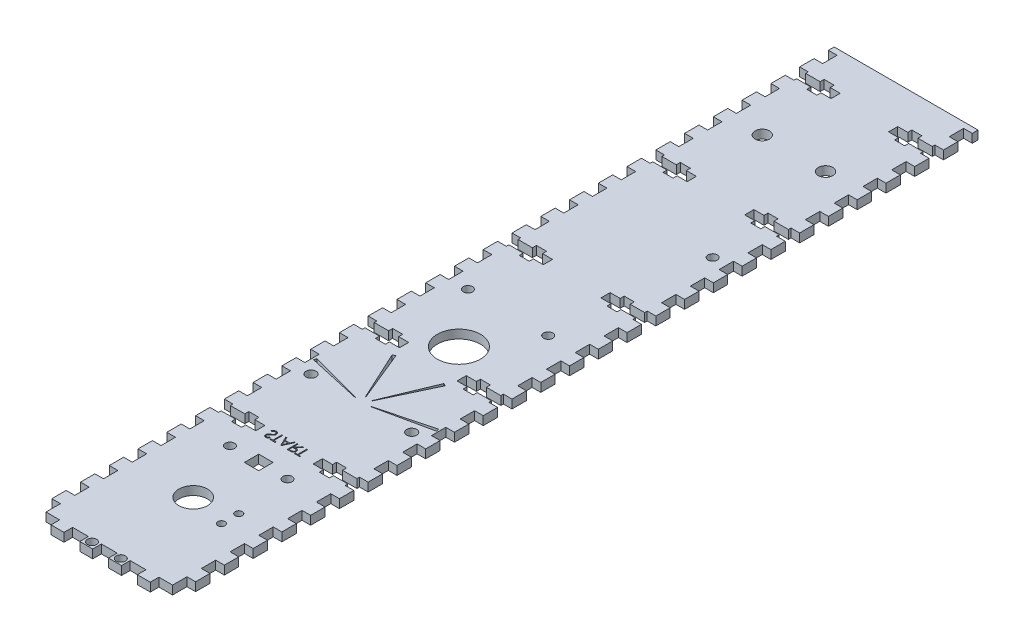
from build123d import *

# Parameters (mm, degrees)
SKETCH1_W                = 50
SKETCH1_H                = 3
BOSS_EXTRUDE1_DEPTH      = 277
SKETCH3_W                = 3
SKETCH3_H                = 5
CUT_EXTRUDE1_DEPTH       = 3
SKETCH6_W                = 4.5
SKETCH6_H                = 3
BOSS_EXTRUDE2_DEPTH      = 3
SKETCH9_W                = 3.2
SKETCH9_H                = 3
CUT_EXTRUDE2_DEPTH       = 12
SKETCH10_W               = 3.2
SKETCH10_H               = 3
CUT_EXTRUDE3_DEPTH       = 12
SKETCH11_W               = 3.5
SKETCH11_H               = 6
CUT_EXTRUDE4_DEPTH       = 12
SKETCH12_R               = 1.6
CUT_EXTRUDE5_DEPTH       = 12
SKETCH13_W               = 13.507600327
SKETCH13_H               = 7.782716217
SKETCH13_W_2             = 12.746384977
SKETCH13_H_2             = 8.044998476
BOSS_EXTRUDE3_DEPTH      = 3
SKETCH14_R               = 2.5
CUT_EXTRUDE6_DEPTH       = 292.149515035
SKETCH15_R               = 1.6
SKETCH15_R_2             = 7.5
CUT_EXTRUDE7_DEPTH       = 292.149515035
SKETCH16_R               = 1.25
SKETCH16_R_2             = 5
CUT_EXTRUDE8_DEPTH       = 292.149515035
SKETCH17_R               = 1.6
SKETCH17_W               = 5
SKETCH17_H               = 5
CUT_EXTRUDE9_DEPTH       = 10
CUT_EXTRUDE10_DEPTH      = 292.14951516
CUT_EXTRUDE10_DEPTH_BACK = 292.14951516
SKETCH18_R               = 1.75


with BuildPart() as part:
    # Sketch1 → Boss-Extrude1 (new body)
    with BuildSketch(Plane.XY):
        with Locations((-54.743589744, 28.628205128)):
            Rectangle(SKETCH1_W, SKETCH1_H)
    extrude(amount=BOSS_EXTRUDE1_DEPTH)

    # Sketch3 → Cut-Extrude1 (cut)
    with BuildSketch(Plane(origin=(0, 30.128205128, 0), x_dir=(1, 0, 0), z_dir=(0, 1, 0))):
        with Locations((-78.243589744, -274.5)):
            Rectangle(SKETCH3_W, SKETCH3_H)
        with Locations((-31.243589744, -274.5)):
            Rectangle(SKETCH3_W, SKETCH3_H)
        with Locations((-78.243589744, -264.5)):
            Rectangle(SKETCH3_W, SKETCH3_H)
        with Locations((-31.243589744, -264.5)):
            Rectangle(SKETCH3_W, SKETCH3_H)
        with Locations((-78.243589744, -254.5)):
            Rectangle(SKETCH3_W, SKETCH3_H)
        with Locations((-31.243589744, -254.5)):
            Rectangle(SKETCH3_W, SKETCH3_H)
        with Locations((-78.243589744, -244.5)):
            Rectangle(SKETCH3_W, SKETCH3_H)
        with Locations((-31.243589744, -244.5)):
            Rectangle(SKETCH3_W, SKETCH3_H)
        with Locations((-78.243589744, -234.5)):
            Rectangle(SKETCH3_W, SKETCH3_H)
        with Locations((-31.243589744, -234.5)):
            Rectangle(SKETCH3_W, SKETCH3_H)
        with Locations((-78.243589744, -224.5)):
            Rectangle(SKETCH3_W, SKETCH3_H)
        with Locations((-31.243589744, -224.5)):
            Rectangle(SKETCH3_W, SKETCH3_H)
        with Locations((-78.243589744, -214.5)):
            Rectangle(SKETCH3_W, SKETCH3_H)
        with Locations((-31.243589744, -214.5)):
            Rectangle(SKETCH3_W, SKETCH3_H)
        with Locations((-78.243589744, -204.5)):
            Rectangle(SKETCH3_W, SKETCH3_H)
        with Locations((-31.243589744, -204.5)):
            Rectangle(SKETCH3_W, SKETCH3_H)
        with Locations((-78.243589744, -194.5)):
            Rectangle(SKETCH3_W, SKETCH3_H)
        with Locations((-31.243589744, -194.5)):
            Rectangle(SKETCH3_W, SKETCH3_H)
        with Locations((-78.243589744, -184.5)):
            Rectangle(SKETCH3_W, SKETCH3_H)
        with Locations((-31.243589744, -184.5)):
            Rectangle(SKETCH3_W, SKETCH3_H)
        with Locations((-78.243589744, -174.5)):
            Rectangle(SKETCH3_W, SKETCH3_H)
        with Locations((-31.243589744, -174.5)):
            Rectangle(SKETCH3_W, SKETCH3_H)
        with Locations((-78.243589744, -164.5)):
            Rectangle(SKETCH3_W, SKETCH3_H)
        with Locations((-31.243589744, -164.5)):
            Rectangle(SKETCH3_W, SKETCH3_H)
        with Locations((-78.243589744, -154.5)):
            Rectangle(SKETCH3_W, SKETCH3_H)
        with Locations((-31.243589744, -154.5)):
            Rectangle(SKETCH3_W, SKETCH3_H)
        with Locations((-78.243589744, -144.5)):
            Rectangle(SKETCH3_W, SKETCH3_H)
        with Locations((-31.243589744, -144.5)):
            Rectangle(SKETCH3_W, SKETCH3_H)
        with Locations((-78.243589744, -134.5)):
            Rectangle(SKETCH3_W, SKETCH3_H)
        with Locations((-31.243589744, -134.5)):
            Rectangle(SKETCH3_W, SKETCH3_H)
        with Locations((-78.243589744, -124.5)):
            Rectangle(SKETCH3_W, SKETCH3_H)
        with Locations((-31.243589744, -124.5)):
            Rectangle(SKETCH3_W, SKETCH3_H)
        with Locations((-78.243589744, -114.5)):
            Rectangle(SKETCH3_W, SKETCH3_H)
        with Locations((-31.243589744, -114.5)):
            Rectangle(SKETCH3_W, SKETCH3_H)
        with Locations((-78.243589744, -104.5)):
            Rectangle(SKETCH3_W, SKETCH3_H)
        with Locations((-31.243589744, -104.5)):
            Rectangle(SKETCH3_W, SKETCH3_H)
        with Locations((-78.243589744, -94.5)):
            Rectangle(SKETCH3_W, SKETCH3_H)
        with Locations((-31.243589744, -94.5)):
            Rectangle(SKETCH3_W, SKETCH3_H)
        with Locations((-78.243589744, -84.5)):
            Rectangle(SKETCH3_W, SKETCH3_H)
        with Locations((-31.243589744, -84.5)):
            Rectangle(SKETCH3_W, SKETCH3_H)
        with Locations((-78.243589744, -74.5)):
            Rectangle(SKETCH3_W, SKETCH3_H)
        with Locations((-31.243589744, -74.5)):
            Rectangle(SKETCH3_W, SKETCH3_H)
        with Locations((-78.243589744, -64.5)):
            Rectangle(SKETCH3_W, SKETCH3_H)
        with Locations((-31.243589744, -64.5)):
            Rectangle(SKETCH3_W, SKETCH3_H)
        with Locations((-78.243589744, -54.5)):
            Rectangle(SKETCH3_W, SKETCH3_H)
        with Locations((-31.243589744, -54.5)):
            Rectangle(SKETCH3_W, SKETCH3_H)
        with Locations((-78.243589744, -44.5)):
            Rectangle(SKETCH3_W, SKETCH3_H)
        with Locations((-31.243589744, -44.5)):
            Rectangle(SKETCH3_W, SKETCH3_H)
        with Locations((-78.243589744, -34.5)):
            Rectangle(SKETCH3_W, SKETCH3_H)
        with Locations((-31.243589744, -34.5)):
            Rectangle(SKETCH3_W, SKETCH3_H)
        with Locations((-78.243589744, -24.5)):
            Rectangle(SKETCH3_W, SKETCH3_H)
        with Locations((-31.243589744, -24.5)):
            Rectangle(SKETCH3_W, SKETCH3_H)
        with Locations((-78.243589744, -14.5)):
            Rectangle(SKETCH3_W, SKETCH3_H)
        with Locations((-31.243589744, -14.5)):
            Rectangle(SKETCH3_W, SKETCH3_H)
        with Locations((-78.243589744, -4.5)):
            Rectangle(SKETCH3_W, SKETCH3_H)
        with Locations((-31.243589744, -4.5)):
            Rectangle(SKETCH3_W, SKETCH3_H)
    extrude(amount=-CUT_EXTRUDE1_DEPTH, mode=Mode.SUBTRACT)

    # Sketch6 → Boss-Extrude2 (add)
    with BuildSketch(Plane.XY.offset(277)):
        with Locations((-69.743589744, 28.628205128)):
            Rectangle(SKETCH6_W, SKETCH6_H)
        with Locations((-59.743589744, 28.628205128)):
            Rectangle(SKETCH6_W, SKETCH6_H)
        with Locations((-49.743589744, 28.628205128)):
            Rectangle(SKETCH6_W, SKETCH6_H)
        with Locations((-39.743589744, 28.628205128)):
            Rectangle(SKETCH6_W, SKETCH6_H)
    extrude(amount=BOSS_EXTRUDE2_DEPTH)

    # Sketch9 → Cut-Extrude2 (cut)
    with BuildSketch(Plane(origin=(-32.743589744, 0, 0), x_dir=(0, 0, -1), z_dir=(1, 0, 0))):
        with Locations((-264.5, 28.628205128)):
            Rectangle(SKETCH9_W, SKETCH9_H)
        with Locations((-214.5, 28.628205128)):
            Rectangle(SKETCH9_W, SKETCH9_H)
        with Locations((-164.5, 28.628205128)):
            Rectangle(SKETCH9_W, SKETCH9_H)
        with Locations((-114.5, 28.628205128)):
            Rectangle(SKETCH9_W, SKETCH9_H)
        with Locations((-64.5, 28.628205128)):
            Rectangle(SKETCH9_W, SKETCH9_H)
        with Locations((-14.5, 28.628205128)):
            Rectangle(SKETCH9_W, SKETCH9_H)
    extrude(amount=-CUT_EXTRUDE2_DEPTH, mode=Mode.SUBTRACT)

    # Sketch10 → Cut-Extrude3 (cut)
    with BuildSketch(Plane.ZY.offset(76.743589744)):
        with Locations((264.5, 28.628205128)):
            Rectangle(SKETCH10_W, SKETCH10_H)
        with Locations((214.5, 28.628205128)):
            Rectangle(SKETCH10_W, SKETCH10_H)
        with Locations((164.5, 28.628205128)):
            Rectangle(SKETCH10_W, SKETCH10_H)
        with Locations((114.5, 28.628205128)):
            Rectangle(SKETCH10_W, SKETCH10_H)
        with Locations((64.5, 28.628205128)):
            Rectangle(SKETCH10_W, SKETCH10_H)
        with Locations((14.5, 28.628205128)):
            Rectangle(SKETCH10_W, SKETCH10_H)
    extrude(amount=-CUT_EXTRUDE3_DEPTH, mode=Mode.SUBTRACT)

    # Sketch11 → Cut-Extrude4 (cut)
    with BuildSketch(Plane.XZ.offset(-27.128205128)):
        with Locations((-69.993589744, 264.5)):
            Rectangle(SKETCH11_W, SKETCH11_H)
        with Locations((-39.493589744, 264.5)):
            Rectangle(SKETCH11_W, SKETCH11_H)
        with Locations((-69.993589744, 214.5)):
            Rectangle(SKETCH11_W, SKETCH11_H)
        with Locations((-39.493589744, 214.5)):
            Rectangle(SKETCH11_W, SKETCH11_H)
        with Locations((-69.993589744, 164.5)):
            Rectangle(SKETCH11_W, SKETCH11_H)
        with Locations((-39.493589744, 164.5)):
            Rectangle(SKETCH11_W, SKETCH11_H)
        with Locations((-69.993589744, 114.5)):
            Rectangle(SKETCH11_W, SKETCH11_H)
        with Locations((-39.493589744, 114.5)):
            Rectangle(SKETCH11_W, SKETCH11_H)
        with Locations((-69.993589744, 64.5)):
            Rectangle(SKETCH11_W, SKETCH11_H)
        with Locations((-39.493589744, 64.5)):
            Rectangle(SKETCH11_W, SKETCH11_H)
        with Locations((-69.993589744, 14.5)):
            Rectangle(SKETCH11_W, SKETCH11_H)
        with Locations((-39.493589744, 14.5)):
            Rectangle(SKETCH11_W, SKETCH11_H)
    extrude(amount=-CUT_EXTRUDE4_DEPTH, mode=Mode.SUBTRACT)

    # Sketch12 → Cut-Extrude5 (cut)
    with BuildSketch(Plane.XZ.offset(-27.128205128)):
        with Locations((-59.743589744, 278)):
            Circle(SKETCH12_R)
        with Locations((-49.743589744, 278)):
            Circle(SKETCH12_R)
    extrude(amount=-CUT_EXTRUDE5_DEPTH, mode=Mode.SUBTRACT)

    # Sketch13 → Boss-Extrude3 (add)
    with BuildSketch(Plane.XZ.offset(-27.128205128)):
        with Locations((-69.989789581, 264.201168399)):
            Rectangle(SKETCH13_W, SKETCH13_H)
        with Locations((-39.116782233, 264.897933796)):
            Rectangle(SKETCH13_W_2, SKETCH13_H_2)
    extrude(amount=-BOSS_EXTRUDE3_DEPTH)

    # Sketch14 → Cut-Extrude6 (cut, through all)
    with BuildSketch(Plane.XZ.offset(-27.128205128)):
        with Locations((-65.743589744, 39)):
            Circle(SKETCH14_R)
        with Locations((-43.743589744, 39)):
            Circle(SKETCH14_R)
    extrude(amount=-CUT_EXTRUDE6_DEPTH, mode=Mode.SUBTRACT)

    # Sketch15 → Cut-Extrude7 (cut, through all)
    with BuildSketch(Plane.XZ.offset(-27.128205128)):
        with Locations((-70.450886663, 136.602790149)):
            Circle(SKETCH15_R)
        with Locations((-42.550886663, 136.602790149)):
            Circle(SKETCH15_R)
        with Locations((-37.500886663, 84.502790149)):
            Circle(SKETCH15_R)
        with Locations((-54.743589744, 155.461682015)):
            Circle(SKETCH15_R_2)
    extrude(amount=-CUT_EXTRUDE7_DEPTH, mode=Mode.SUBTRACT)

    # Sketch16 → Cut-Extrude8 (cut, through all)
    with BuildSketch(Plane.XZ.offset(-27.128205128)):
        with Locations((-42.743589744, 250)):
            Circle(SKETCH16_R)
        with Locations((-42.743589744, 244)):
            Circle(SKETCH16_R)
        with Locations((-55.566311228, 247)):
            Circle(SKETCH16_R_2)
    extrude(amount=-CUT_EXTRUDE8_DEPTH, mode=Mode.SUBTRACT)

    # Sketch17 → Cut-Extrude9 (cut)
    # profile 1 of 8: a face of its own
    with BuildSketch(Plane.XZ.offset(-27.128205128)):
        with Locations((-64.684119458, 225.103941312)):
            Circle(SKETCH17_R)
    # profile 2 of 8: a face of its own
    with BuildSketch(Plane.XZ.offset(-27.128205128)):
        with Locations((-44.684119458, 225.103941312)):
            Circle(SKETCH17_R)
    # profile 3 of 8: a face of its own
    with BuildSketch(Plane.XZ.offset(-27.128205128)):
        with Locations((-54.684119458, 225.103941312)):
            Rectangle(SKETCH17_W, SKETCH17_H)
    # profile 4 of 8: a face of its own
    with BuildSketch(Plane.XZ.offset(-27.128205128)):
        with BuildLine():
            Line((-62.097172473, 213.420253416), (-61.801299075, 213.59763723))
            add(Edge.make_bspline(
                [(-61.801299075, 213.59763723), (-61.773780838, 213.551572845), (-61.721056957, 213.463315261), (-61.633105598, 213.344057221), (-61.541972687, 213.242695064), (-61.446983354, 213.159818456), (-61.348717405, 213.09456957), (-61.246533352, 213.048367338), (-61.140775541, 213.019551363), (-61.068801719, 213.016051276), (-61.032869588, 213.014303897)],
                knots=[0, 0, 0, 0, 1.272034388, 2.437168799, 3.508375237, 4.49857839, 5.41946034, 6.295179144, 7.148887113, 8, 8, 8, 8], degree=3))
            add(Edge.make_bspline(
                [(-61.032869588, 213.014303897), (-61.002182728, 213.015158569), (-60.941345955, 213.016852959), (-60.851783712, 213.033133762), (-60.764801909, 213.05814589), (-60.682193272, 213.093966822), (-60.605097657, 213.137305308), (-60.537490962, 213.189651485), (-60.479044849, 213.248257691), (-60.431235734, 213.313640346), (-60.394555699, 213.383957494), (-60.36636363, 213.456133445), (-60.350718557, 213.531302014), (-60.348361803, 213.581912477), (-60.347172473, 213.607452935)],
                knots=[0, 0, 0, 0, 1.095163259, 2.171163733, 3.241058638, 4.321873601, 5.38011039, 6.391990106, 7.366004449, 8.327778327, 9.272591725, 10.192022065, 11.087607919, 12, 12, 12, 12], degree=3))
            add(Edge.make_bspline(
                [(-60.347172473, 213.607452935), (-60.348646783, 213.636593785), (-60.351643842, 213.695832874), (-60.376975322, 213.783232527), (-60.416824569, 213.869725097), (-60.453587212, 213.923226363), (-60.472673274, 213.951002615)],
                knots=[0, 0, 0, 0, 0.938893495, 1.908633276, 2.914225137, 4, 4, 4, 4], degree=3))
            add(Edge.make_bspline(
                [(-60.472673274, 213.951002615), (-60.488343888, 213.971049438), (-60.521242382, 214.013135237), (-60.577799895, 214.075780472), (-60.644166009, 214.140398891), (-60.718069564, 214.209457948), (-60.802202653, 214.279745745), (-60.893930167, 214.354614023), (-60.995594026, 214.4312156), (-61.066893523, 214.482588165), (-61.103682889, 214.509095563)],
                knots=[0, 0, 0, 0, 0.722233717, 1.516239348, 2.393582979, 3.351407094, 4.387010283, 5.505090956, 6.712668013, 8, 8, 8, 8], degree=3))
            add(Edge.make_bspline(
                [(-61.103682889, 214.509095563), (-61.140506886, 214.535324151), (-61.210911562, 214.585471213), (-61.309370144, 214.659895497), (-61.397414607, 214.727939367), (-61.474653624, 214.790243379), (-61.541053221, 214.846815984), (-61.597136632, 214.897113923), (-61.641475189, 214.942497484), (-61.66613077, 214.971938825), (-61.677200518, 214.985157262)],
                knots=[0, 0, 0, 0, 1.452282411, 2.77665338, 3.964542531, 5.026858415, 5.96415736, 6.766646006, 7.446254459, 8, 8, 8, 8], degree=3))
            add(Edge.make_bspline(
                [(-61.677200518, 214.985157262), (-61.692673063, 215.005758299), (-61.7231019, 215.046273003), (-61.763267905, 215.10959786), (-61.797407068, 215.174421126), (-61.8241694, 215.24091699), (-61.846705619, 215.308151919), (-61.861863549, 215.377003165), (-61.871354946, 215.447161784), (-61.872326933, 215.494375284), (-61.872813498, 215.518009826)],
                knots=[0, 0, 0, 0, 1.068054152, 2.10047183, 3.106115577, 4.101338837, 5.06977816, 6.043150881, 7.020423561, 8, 8, 8, 8], degree=3))
            add(Edge.make_bspline(
                [(-61.872813498, 215.518009826), (-61.871508289, 215.555039601), (-61.868925769, 215.628307664), (-61.847085252, 215.735338495), (-61.812612358, 215.837524912), (-61.76431747, 215.933855246), (-61.702060118, 216.021821227), (-61.630014143, 216.102434714), (-61.544202657, 216.170203296), (-61.450050034, 216.229415354), (-61.346993662, 216.27576128), (-61.239002758, 216.31072226), (-61.125905686, 216.330531517), (-61.049302552, 216.333374282), (-61.010433691, 216.334816717)],
                knots=[0, 0, 0, 0, 1.005424448, 1.989358655, 2.955360095, 3.929531133, 4.905563448, 5.876582895, 6.856512386, 7.866279853, 8.892233794, 9.918561126, 10.94386622, 12, 12, 12, 12], degree=3))
            add(Edge.make_bspline(
                [(-61.010433691, 216.334816717), (-60.96918959, 216.333394166), (-60.887168239, 216.330565165), (-60.766519023, 216.305967633), (-60.650358307, 216.265266961), (-60.556915042, 216.219078303), (-60.48378228, 216.172946888), (-60.428009548, 216.130927063), (-60.371492097, 216.082551955), (-60.313774042, 216.027692709), (-60.255833383, 215.965845958), (-60.19680993, 215.897435269), (-60.136565662, 215.822878713), (-60.097809801, 215.769654212), (-60.077941703, 215.742368801)],
                knots=[0, 0, 0, 0, 1.286793592, 2.559021753, 3.825965368, 5.121522368, 5.803751409, 6.523245864, 7.299691795, 8.125521123, 9.008227632, 9.944561021, 10.946284179, 12, 12, 12, 12], degree=3))
            Line((-60.077941703, 215.742368801), (-60.36189603, 215.52712441))
            add(Edge.make_bspline(
                [(-60.36189603, 215.52712441), (-60.379041963, 215.5492131), (-60.41206102, 215.591750753), (-60.462190507, 215.651322069), (-60.509439155, 215.705738548), (-60.555989554, 215.753003676), (-60.599383186, 215.79570581), (-60.641500228, 215.832265567), (-60.681734579, 215.863041162), (-60.73245149, 215.895884722), (-60.796169208, 215.928441225), (-60.876153745, 215.955990304), (-60.95974002, 215.972545365), (-61.016669651, 215.974734253), (-61.04548978, 215.975842358)],
                knots=[0, 0, 0, 0, 1.181633172, 2.275549214, 3.290209073, 4.226197932, 5.078386478, 5.862611352, 6.581680152, 7.217281963, 8.414376989, 9.595101626, 10.782541182, 12, 12, 12, 12], degree=3))
            add(Edge.make_bspline(
                [(-61.04548978, 215.975842358), (-61.081646303, 215.974630658), (-61.15137075, 215.972294009), (-61.250360986, 215.946774024), (-61.339454911, 215.906592163), (-61.416007476, 215.850277185), (-61.479744453, 215.783556193), (-61.525849912, 215.706777338), (-61.553600077, 215.621994935), (-61.556986356, 215.562853279), (-61.558710934, 215.532733384)],
                knots=[0, 0, 0, 0, 1.14458467, 2.207223713, 3.21896685, 4.227309161, 5.202851033, 6.127160689, 7.046193047, 8, 8, 8, 8], degree=3))
            add(Edge.make_bspline(
                [(-61.558710934, 215.532733384), (-61.558317808, 215.513981905), (-61.557530911, 215.476448286), (-61.546556114, 215.420996864), (-61.532456785, 215.365685525), (-61.510114153, 215.310762942), (-61.479268849, 215.255268583), (-61.438763674, 215.198246845), (-61.387750362, 215.139195136), (-61.348673349, 215.100787763), (-61.328041864, 215.080509826)],
                knots=[0, 0, 0, 0, 0.858281714, 1.717966888, 2.583508476, 3.4729293, 4.427298488, 5.488583878, 6.674047936, 8, 8, 8, 8], degree=3))
            add(Edge.make_bspline(
                [(-61.328041864, 215.080509826), (-61.320380491, 215.0736728), (-61.302178824, 215.057429592), (-61.268902898, 215.030837311), (-61.2249601, 214.998034539), (-61.171497899, 214.957447223), (-61.107530537, 214.910365761), (-61.033050981, 214.857392148), (-60.948889448, 214.796806689), (-60.889167532, 214.754449149), (-60.857589139, 214.732052294)],
                knots=[0, 0, 0, 0, 0.420754252, 0.999615792, 1.744751191, 2.668019286, 3.750313428, 4.999500688, 6.413464383, 8, 8, 8, 8], degree=3))
            add(Edge.make_bspline(
                [(-60.857589139, 214.732052294), (-60.819603226, 214.704410935), (-60.74604877, 214.650887273), (-60.64139119, 214.570471593), (-60.546497382, 214.491823824), (-60.461034178, 214.415446217), (-60.38415727, 214.341918124), (-60.316719549, 214.270354944), (-60.258033869, 214.201269371), (-60.19485465, 214.112696795), (-60.130296831, 214.003915711), (-60.074855323, 213.870637473), (-60.039896976, 213.736841152), (-60.03532546, 213.646914316), (-60.033069909, 213.602545083)],
                knots=[0, 0, 0, 0, 1.163667725, 2.253281268, 3.268753668, 4.215851969, 5.092017293, 5.902905408, 6.650798638, 7.335211899, 8.59617414, 9.77448103, 10.901945474, 12, 12, 12, 12], degree=3))
            add(Edge.make_bspline(
                [(-60.033069909, 213.602545083), (-60.033727047, 213.571166718), (-60.035028562, 213.509019334), (-60.049989476, 213.417764257), (-60.071909141, 213.329133387), (-60.104946375, 213.244222275), (-60.145269533, 213.161477512), (-60.196435781, 213.083069612), (-60.255743466, 213.007263213), (-60.32377723, 212.936079722), (-60.398223133, 212.870733526), (-60.476906827, 212.812604464), (-60.5599571, 212.764136141), (-60.646923417, 212.724585299), (-60.737825754, 212.693651781), (-60.832633538, 212.671238912), (-60.931503049, 212.657483201), (-60.99870353, 212.65605544), (-61.032869588, 212.655329538)],
                knots=[0, 0, 0, 0, 0.983748083, 1.948392443, 2.894712957, 3.844097841, 4.80183111, 5.778335162, 6.776009319, 7.81870978, 8.863265674, 9.881300176, 10.883814829, 11.87499822, 12.874611388, 13.892143829, 14.928324115, 16, 16, 16, 16], degree=3))
            add(Edge.make_bspline(
                [(-61.032869588, 212.655329538), (-61.059304931, 212.655840719), (-61.111842691, 212.656856645), (-61.189552173, 212.665837925), (-61.265691762, 212.678545029), (-61.339306044, 212.698719099), (-61.411343456, 212.723196076), (-61.48149069, 212.753334408), (-61.549781744, 212.78945161), (-61.616599327, 212.830746634), (-61.681773502, 212.878804379), (-61.74469297, 212.934777875), (-61.807422155, 212.99712338), (-61.868109551, 213.067533944), (-61.927982696, 213.144872027), (-61.985861105, 213.22986121), (-62.042942823, 213.322038564), (-62.078758291, 213.38690365), (-62.097172473, 213.420253416)],
                knots=[0, 0, 0, 0, 0.915332311, 1.819136955, 2.706846663, 3.586547465, 4.459518054, 5.340707479, 6.227863349, 7.133153174, 8.059268498, 9.028702269, 10.047606654, 11.120612155, 12.245963614, 13.433783089, 14.680604001, 16, 16, 16, 16], degree=3))
        make_face()
    # profile 5 of 8: a face of its own
    with BuildSketch(Plane.XZ.offset(-27.128205128)):
        Polygon((-59.718967344, 215.886098769), (-59.718967344, 216.245073127), (-57.879223755, 216.245073127), (-57.879223755, 215.886098769), (-58.642044268, 215.886098769), (-58.642044268, 212.745073127), (-58.956146832, 212.745073127), (-58.956146832, 215.886098769), align=None)
    # profile 6 of 8: a face of its own
    with BuildSketch(Plane.XZ.offset(-27.128205128)):
        Polygon((-55.90486478, 216.245073127), (-54.289480165, 212.745073127), (-54.630926479, 212.745073127), (-55.148354364, 213.866867999), (-56.734992986, 213.866867999), (-57.267144428, 212.745073127), (-57.609992986, 212.745073127), (-55.949736575, 216.245073127), align=None)
        Polygon((-55.930806287, 215.562881621), (-56.564620389, 214.225842358), (-55.313819107, 214.225842358), align=None, mode=Mode.SUBTRACT)
    # profile 7 of 8: a face of its own
    with BuildSketch(Plane.XZ.offset(-27.128205128)):
        with BuildLine():
            Line((-53.661275037, 216.245073127), (-52.960854364, 216.245073127))
            add(Edge.make_bspline(
                [(-52.960854364, 216.245073127), (-52.914113235, 216.244917541), (-52.824365091, 216.244618799), (-52.69579182, 216.242953036), (-52.578964723, 216.238178681), (-52.473944884, 216.234070097), (-52.380734229, 216.226578156), (-52.299046938, 216.219417509), (-52.229259241, 216.210043848), (-52.18701339, 216.201338425), (-52.167885614, 216.197396845)],
                knots=[0, 0, 0, 0, 1.410062039, 2.707475311, 3.878576406, 4.937260626, 5.877586885, 6.699081471, 7.410979367, 8, 8, 8, 8], degree=3))
            add(Edge.make_bspline(
                [(-52.167885614, 216.197396845), (-52.14227899, 216.19107008), (-52.091612, 216.178551516), (-52.018661934, 216.152091916), (-51.94914761, 216.121472291), (-51.883357786, 216.085508571), (-51.821621995, 216.043933791), (-51.763303684, 215.997465669), (-51.70813822, 215.946358463), (-51.65835659, 215.889323621), (-51.611417539, 215.829487112), (-51.571828912, 215.764783355), (-51.537702432, 215.697121827), (-51.510531915, 215.625814409), (-51.488653942, 215.551552638), (-51.473227702, 215.473663841), (-51.463976515, 215.392502866), (-51.463034659, 215.337144957), (-51.462557088, 215.309075531)],
                knots=[0, 0, 0, 0, 1.027469482, 2.033020251, 3.019912614, 3.986113645, 4.951240523, 5.91722682, 6.890402269, 7.87763091, 8.8651537, 9.85103654, 10.82876324, 11.815024772, 12.821070561, 13.842952187, 14.906261191, 16, 16, 16, 16], degree=3))
            add(Edge.make_bspline(
                [(-51.462557088, 215.309075531), (-51.464026086, 215.262440427), (-51.466892482, 215.171443259), (-51.493617586, 215.039382377), (-51.537394105, 214.916193063), (-51.597717394, 214.802030425), (-51.67453687, 214.69911978), (-51.766861661, 214.608729324), (-51.874743273, 214.533089412), (-51.975172589, 214.480636607), (-52.063886788, 214.447043698), (-52.136920101, 214.423407339), (-52.216587079, 214.405145374), (-52.302124413, 214.388785242), (-52.393888069, 214.376433548), (-52.491658108, 214.367386953), (-52.59550426, 214.361732905), (-52.666843329, 214.3608909), (-52.703542665, 214.360457743)],
                knots=[0, 0, 0, 0, 1.260483769, 2.459530307, 3.627416485, 4.787058657, 5.939039949, 7.08810263, 8.267026773, 9.491475466, 10.141966685, 10.831826277, 11.566392101, 12.351337768, 13.187381173, 14.07005841, 15.007169909, 16, 16, 16, 16], degree=3))
            Line((-52.703542665, 214.360457743), (-51.417685293, 212.745073127))
            Line((-51.417685293, 212.745073127), (-51.806106768, 212.745073127))
            Line((-51.806106768, 212.745073127), (-53.091964139, 214.360457743))
            Line((-53.091964139, 214.360457743), (-53.347172473, 214.360457743))
            Line((-53.347172473, 214.360457743), (-53.347172473, 212.745073127))
            Line((-53.347172473, 212.745073127), (-53.661275037, 212.745073127))
            Line((-53.661275037, 212.745073127), (-53.661275037, 216.245073127))
        make_face()
        with BuildLine():
            Line((-53.347172473, 215.886098769), (-53.347172473, 214.719432102))
            Line((-53.347172473, 214.719432102), (-52.706347152, 214.714524249))
            add(Edge.make_bspline(
                [(-52.706347152, 214.714524249), (-52.676427113, 214.714511013), (-52.618433556, 214.714485356), (-52.534532891, 214.718479132), (-52.45641278, 214.723022451), (-52.384372027, 214.729971796), (-52.318378452, 214.738927868), (-52.258465039, 214.750130852), (-52.204533987, 214.763182915), (-52.141635449, 214.783384541), (-52.071398917, 214.815390559), (-51.995067457, 214.861956058), (-51.93006512, 214.920525177), (-51.875147257, 214.987498633), (-51.831017826, 215.061134882), (-51.799905772, 215.140551251), (-51.780163329, 215.223742849), (-51.777834784, 215.280920957), (-51.776659652, 215.309776653)],
                knots=[0, 0, 0, 0, 1.146690395, 2.22261258, 3.21895312, 4.145990853, 4.996080663, 5.770904154, 6.481378293, 7.121626537, 8.300444488, 9.431385265, 10.535395872, 11.636531494, 12.74115979, 13.810798291, 14.895190096, 16, 16, 16, 16], degree=3))
            add(Edge.make_bspline(
                [(-51.776659652, 215.309776653), (-51.777861773, 215.337923227), (-51.780243939, 215.393699466), (-51.799692707, 215.475355376), (-51.832582089, 215.552422326), (-51.876904326, 215.624586811), (-51.930903481, 215.690092547), (-51.994221294, 215.7461397), (-52.065126489, 215.792389165), (-52.131397688, 215.821943545), (-52.1906319, 215.840063398), (-52.24206156, 215.852814562), (-52.300173038, 215.863059031), (-52.365248496, 215.871267092), (-52.437010127, 215.878322036), (-52.515820778, 215.883073815), (-52.601157559, 215.885887679), (-52.66030449, 215.886026768), (-52.690922473, 215.886098769)],
                knots=[0, 0, 0, 0, 1.101028733, 2.181837193, 3.264309656, 4.369019818, 5.486613113, 6.575447106, 7.666700264, 8.788928104, 9.402425223, 10.0903467, 10.862060571, 11.710948788, 12.657782767, 13.684531032, 14.801375019, 16, 16, 16, 16], degree=3))
            Line((-52.690922473, 215.886098769), (-53.347172473, 215.886098769))
        make_face(mode=Mode.SUBTRACT)
    # profile 8 of 8: a face of its own
    with BuildSketch(Plane.XZ.offset(-27.128205128)):
        Polygon((-51.103582729, 215.886098769), (-51.103582729, 216.245073127), (-49.263839139, 216.245073127), (-49.263839139, 215.886098769), (-50.026659652, 215.886098769), (-50.026659652, 212.745073127), (-50.340762216, 212.745073127), (-50.340762216, 215.886098769), align=None)
    extrude(amount=-CUT_EXTRUDE9_DEPTH, mode=Mode.SUBTRACT)


with BuildPart() as cut_extrude9_piece_1:
    # of the separate pieces the step leaves, piece 1, a body of its own (cut_extrude9_pieces)
    add(part.part.solids().sort_by_distance((-79.743589744, 30.128205128, 0))[0])

    # Sketch18 → Cut-Extrude10 (cut, two sides: drawn at the far end of the back side and taken through both)
    with BuildSketch(Plane.XZ.offset(-27.128205128).offset(-CUT_EXTRUDE10_DEPTH_BACK)):
        with BuildLine():
            ThreePointArc((-55.763589447, 186.785648856), (-55.82362966, 186.810950523), (-55.88307734, 186.837614637))
            Line((-55.88307734, 186.837614637), (-63.885716991, 169.527030688))
            Line((-63.885716991, 169.527030688), (-62.968687695, 169.128210841))
            Line((-62.968687695, 169.128210841), (-55.763589447, 186.785648856))
        make_face()
        with BuildLine():
            Line((-45.351397134, 169.588175182), (-53.468076163, 186.845581696))
            ThreePointArc((-53.468076163, 186.845581696), (-53.527346621, 186.818525933), (-53.58721859, 186.792828677))
            Line((-53.58721859, 186.792828677), (-46.265775095, 169.183313545))
            Line((-46.265775095, 169.183313545), (-45.351397134, 169.588175182))
        make_face()
        with BuildLine():
            ThreePointArc((-51.89144045, 188.827298206), (-51.905922258, 188.763826415), (-51.92184645, 188.700701055))
            Line((-51.92184645, 188.700701055), (-33.484605376, 183.825590839))
            Line((-33.484605376, 183.825590839), (-33.228974299, 184.792365245))
            Line((-33.228974299, 184.792365245), (-51.89144045, 188.827298206))
        make_face()
        with BuildLine():
            Line((-75.846187549, 183.685840498), (-57.441513295, 188.682491742))
            ThreePointArc((-57.441513295, 188.682491742), (-57.457853636, 188.745510661), (-57.472753909, 188.808885521))
            Line((-57.472753909, 188.808885521), (-76.108191746, 184.650907232))
            Line((-76.108191746, 184.650907232), (-75.846187549, 183.685840498))
        make_face()
        with Locations((-72.184119458, 189.431091535)):
            Circle(SKETCH18_R)
        with Locations((-37.184119458, 189.431091535)):
            Circle(SKETCH18_R)
    extrude(amount=CUT_EXTRUDE10_DEPTH + CUT_EXTRUDE10_DEPTH_BACK, mode=Mode.SUBTRACT)


with BuildPart() as cut_extrude9_piece_2:
    # of the separate pieces the step leaves, piece 2, a body of its own (cut_extrude9_pieces)
    add(part.part.solids().sort_by_distance((-52.706347152, 30.128205128, 214.714524249))[0])


with BuildPart() as cut_extrude9_piece_3:
    # of the separate pieces the step leaves, piece 3, a body of its own (cut_extrude9_pieces)
    add(part.part.solids().sort_by_distance((-55.313819107, 30.128205128, 214.225842358))[0])


solid = Compound([cut_extrude9_piece_1.part, cut_extrude9_piece_2.part, cut_extrude9_piece_3.part])
